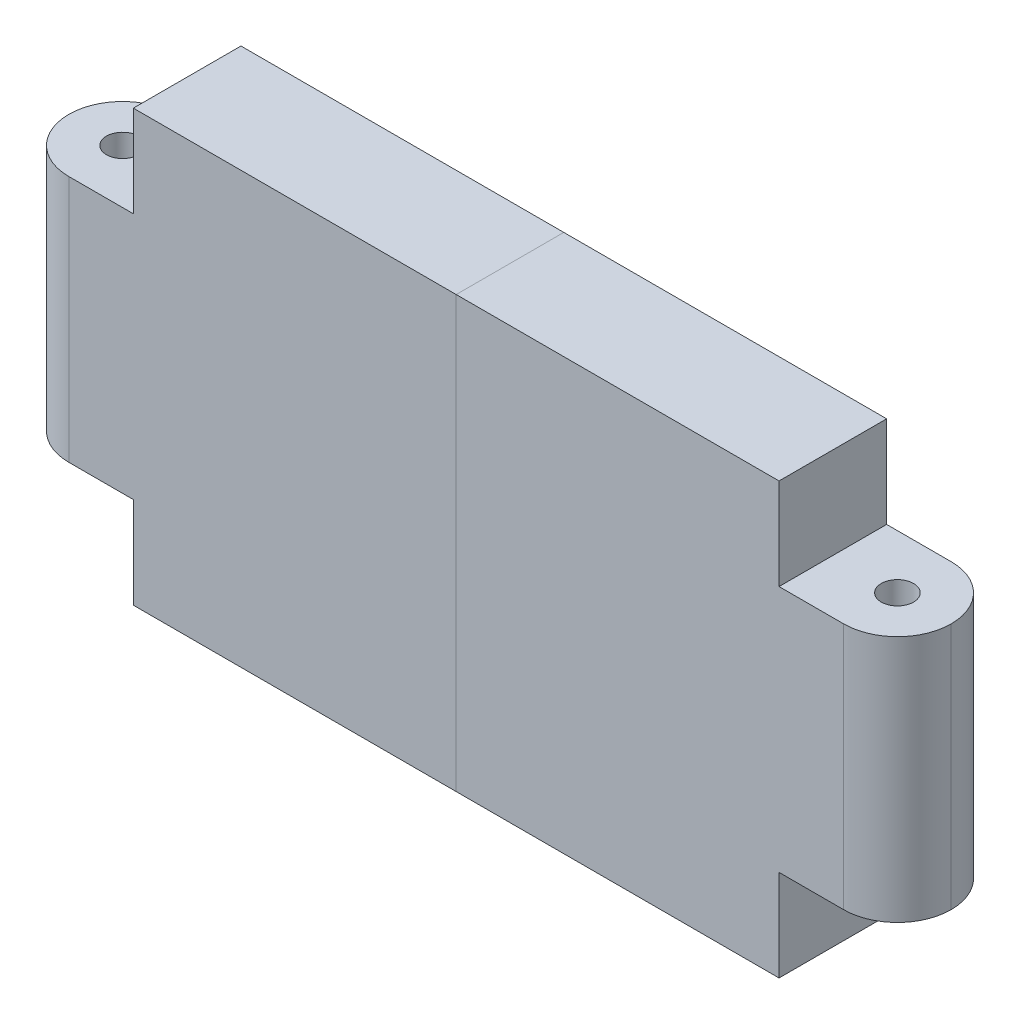
from build123d import *

# Parameters (mm, degrees)
SKETCH_1_W          = 60
SKETCH_1_H          = 40
EXTRUDE_1_DEPTH     = 10
SKETCH_2_W          = 10
SKETCH_2_H          = 23
EXTRUDE_2_DEPTH     = 11
SKETCH_3_R          = 1.5
CUT_EXTRUDE_1_DEPTH = 30
FILLET_1_R          = 5


with BuildPart() as part:
    # 草图1 → 凸台-拉伸1 (new body)
    with BuildSketch(Plane.XY):
        Rectangle(SKETCH_1_W, SKETCH_1_H)
    extrude(amount=EXTRUDE_1_DEPTH)

    # 草图2 → 凸台-拉伸2 (add)
    with BuildSketch(Plane.ZY.offset(30)):
        with Locations((5, 0)):
            Rectangle(SKETCH_2_W, SKETCH_2_H)
    extrude_2 = extrude(amount=EXTRUDE_2_DEPTH)

    # 草图3 → 切除-拉伸1 (cut)
    with BuildSketch(Plane(origin=(0, 11.5, 0), x_dir=(1, 0, 0), z_dir=(0, 1, 0))):
        with Locations(Location((-36, -5, 0), (0, 0, 180))):
            Circle(SKETCH_3_R)
    cut_extrude_1 = extrude(amount=-CUT_EXTRUDE_1_DEPTH, mode=Mode.SUBTRACT)

    # 镜向1: 凸台-拉伸2, 切除-拉伸1 across plane
    add(extrude_2.mirror(Plane(origin=(0, 0, 0), x_dir=(0, 0, 1), z_dir=(1, 0, 0))))
    add(cut_extrude_1.mirror(Plane(origin=(0, 0, 0), x_dir=(0, 0, 1), z_dir=(1, 0, 0))), mode=Mode.SUBTRACT)

    # 圆角1
    fillet_1_edges = [part.edges().sort_by_distance(p)[0] for p in [
        (41, 0, 0),
        (41, 0, 10),
        (-41, 0, 0),
        (-41, 0, 10),
    ]]
    fillet(fillet_1_edges, radius=FILLET_1_R - 0.0001)  # a hair under: the kernel refuses the full size


with BuildPart() as body_2:
    # Split Bodies 1: the piece on the far side of the plane
    add(part.part)
    split(bisect_by=Plane(origin=(0, 0, 0), x_dir=(0, -1, 0), z_dir=(-1, 0, 0)), keep=Keep.BOTTOM)


with BuildPart() as part_1:
    add(part.part)

    # Split Bodies 1
    split(bisect_by=Plane(origin=(0, 0, 0), x_dir=(0, -1, 0), z_dir=(-1, 0, 0)), keep=Keep.TOP)


solid = Compound([body_2.part, part_1.part])
